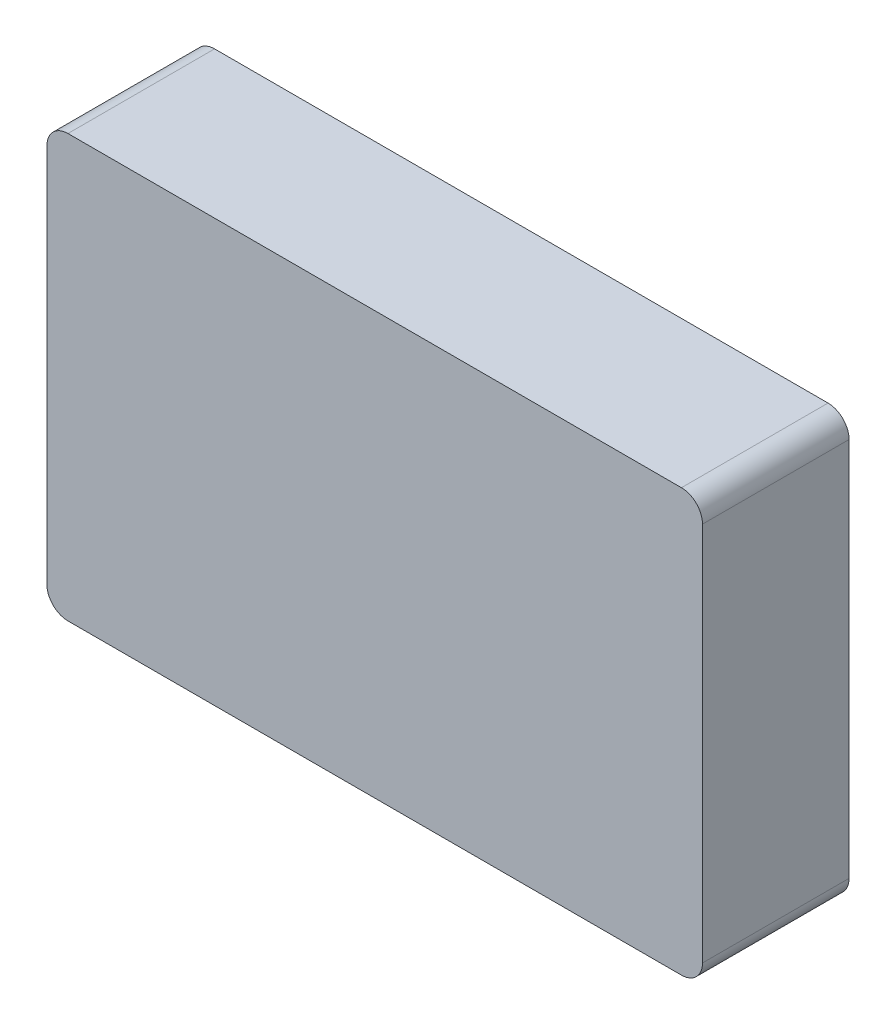
from build123d import *

# Parameters (mm, degrees)
BOSS_EXTRUDE1_DEPTH = 19.5


with BuildPart() as part:
    # Sketch1 → Boss-Extrude1 (new body)
    with BuildSketch(Plane.XY):
        with BuildLine():
            Line((-40.8, -28.075), (40.8, -28.075))
            ThreePointArc((40.8, -28.075), (42.779898987, -27.254898987), (43.6, -25.275))
            Line((43.6, -25.275), (43.6, 25.275))
            ThreePointArc((43.6, 25.275), (42.779898987, 27.254898987), (40.8, 28.075))
            Line((40.8, 28.075), (-40.8, 28.075))
            ThreePointArc((-40.8, 28.075), (-42.779898987, 27.254898987), (-43.6, 25.275))
            Line((-43.6, 25.275), (-43.6, -25.275))
            ThreePointArc((-43.6, -25.275), (-42.779898987, -27.254898987), (-40.8, -28.075))
        make_face()
    extrude(amount=BOSS_EXTRUDE1_DEPTH)


solid = part.part
